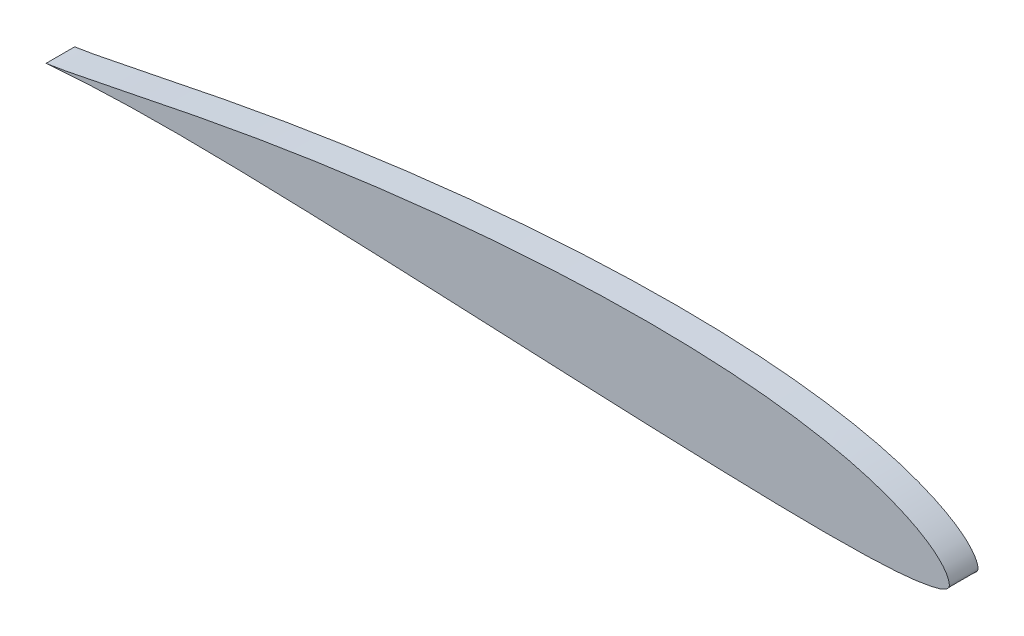
from build123d import *

# Parameters (mm, degrees)
BOSS_EXTRUDE1_START             = -6.35
BOSS_EXTRUDE1_DEPTH             = 12.7
F_1_4_0_25_DIAMETER_HOLE1_D     = 6.35
F_1_4_0_25_DIAMETER_HOLE1_DEPTH = 12.7
F_1_4_0_25_DIAMETER_HOLE1_TIP   = 1.907732465


# Read off the part's stored shape, not the designer's step: Boss-Extrude1
with BuildPart() as part:
    # Boss-Extrude1 outline → Boss-Extrude1 (new body)
    with BuildSketch(Plane.XY.offset(BOSS_EXTRUDE1_START)):
        with BuildLine():
            add(Edge.make_bspline(
                [(1920.065230881, -24.617553068), (1920.130155874, -24.618859237), (1925.575671504, -24.728068197), (1935.851835275, -24.879341033), (1950.294225265, -24.873913501), (1962.94157873, -24.607075919), (1973.680217277, -24.018312057), (1982.398693885, -23.198555209), (1989.092962876, -21.911481607), (1993.573509878, -20.757056382), (1996.680674803, -18.45740561), (1995.81152487, -15.023656975), (1993.774843402, -11.790735056), (1990.036037361, -8.113508837), (1984.733737642, -4.431831266), (1977.844554661, -0.738000891), (1969.417656719, 2.808294672), (1959.492539083, 6.113040903), (1948.102960554, 9.029414447), (1935.324358877, 11.524302647), (1921.241254318, 13.586927955), (1905.948079172, 15.125700306), (1889.560689958, 16.151318036), (1872.209523798, 16.665321066), (1854.046010628, 16.673958659), (1835.234936392, 16.199890951), (1815.950771465, 15.263532756), (1796.375737061, 13.903335194), (1776.702995065, 12.158299244), (1757.131347121, 10.074462559), (1737.859396429, 7.71225563), (1719.08684801, 5.114738752), (1701.004738012, 2.340739823), (1683.796710447, -0.560040691), (1667.628319222, -3.513963912), (1652.667820342, -6.429305749), (1639.067085138, -9.191638816), (1627.059200439, -11.669154331), (1616.687958051, -13.784821463), (1608.592564656, -15.393254745), (1601.880922987, -16.582318895), (1599.080530195, -17.090621134), (1596.310176943, -17.466404803), (1596.310214133, -17.478209275), (1596.310251531, -17.49007988), (1599.132242331, -17.202233092), (1602.03182261, -16.990713681), (1609.107201091, -16.481630519), (1617.8434683, -16.012258133), (1629.299720869, -15.576002659), (1642.816734934, -15.309115057), (1658.334480536, -15.286405147), (1675.531547401, -15.489758003), (1694.16050143, -15.916875978), (1713.951569092, -16.536340478), (1730.122840386, -17.144431918), (1739.668261537, -17.523747642), (1742.287842214, -17.629400283)],
                knots=[0.398030455, 0.398030455, 0.398030455, 0.398030455, 0.398269789, 0.418104249, 0.43590731, 0.451493631, 0.46472819, 0.475515633, 0.483813435, 0.489622354, 0.493000171, 0.496319033, 0.50112136, 0.507407278, 0.515327376, 0.524908128, 0.53614475, 0.548990968, 0.563425422, 0.579445898, 0.596955554, 0.615864818, 0.636077717, 0.657458391, 0.679831385, 0.703012206, 0.7268029, 0.750982326, 0.775326426, 0.799588584, 0.823519225, 0.846883029, 0.869432575, 0.890938902, 0.911197778, 0.930003617, 0.947123678, 0.962312644, 0.975299445, 0.985817342, 0.99359188, 0.998380799, 1, 1, 1, 1.001628273, 1.00649051, 1.014519384, 1.025626772, 1.039665978, 1.056415868, 1.075575198, 1.096814477, 1.119812494, 1.14424643, 1.169791911, 1.179454382, 1.179454382, 1.179454382, 1.179454382], degree=3))
            Line((1742.287842214, -17.629400283), (1767.665230881, -18.700915307))
            add(Edge.make_bspline(
                [(1767.665230881, -18.700915307), (1770.999482071, -18.847287768), (1781.644331549, -19.319817195), (1799.55769772, -20.129354159), (1821.283142971, -21.101283805), (1842.645167097, -22.011627553), (1863.405482029, -22.852913443), (1880.682012821, -23.485328784), (1891.0123147, -23.827445692), (1894.674197882, -23.94268775)],
                knots=[0.210658832, 0.210658832, 0.210658832, 0.210658832, 0.222959253, 0.249929689, 0.276747065, 0.303109783, 0.328732167, 0.353323187, 0.366825955, 0.366825955, 0.366825955, 0.366825955], degree=3))
            Line((1894.674197882, -23.94268775), (1920.065230881, -24.617553068))
        make_face()
    extrude(amount=BOSS_EXTRUDE1_DEPTH)

    # 1/4 (0.25) Diameter Hole1
    with Locations(Plane(origin=(0.701602531, 26.396989956, 0), x_dir=(-0.999646968500425, 0.02656950070871867, 0), z_dir=(-0.02656950070871867, -0.999646968500425, 0))):
        with Locations((-1907.341463467, 0), (-1754.838063357, 0)):
            Hole(F_1_4_0_25_DIAMETER_HOLE1_D / 2, depth=F_1_4_0_25_DIAMETER_HOLE1_DEPTH)
            with Locations((0, 0, -(F_1_4_0_25_DIAMETER_HOLE1_DEPTH + F_1_4_0_25_DIAMETER_HOLE1_TIP / 2))):  # 118° drill point
                Cone(0, F_1_4_0_25_DIAMETER_HOLE1_D / 2, F_1_4_0_25_DIAMETER_HOLE1_TIP, mode=Mode.SUBTRACT)


solid = part.part
